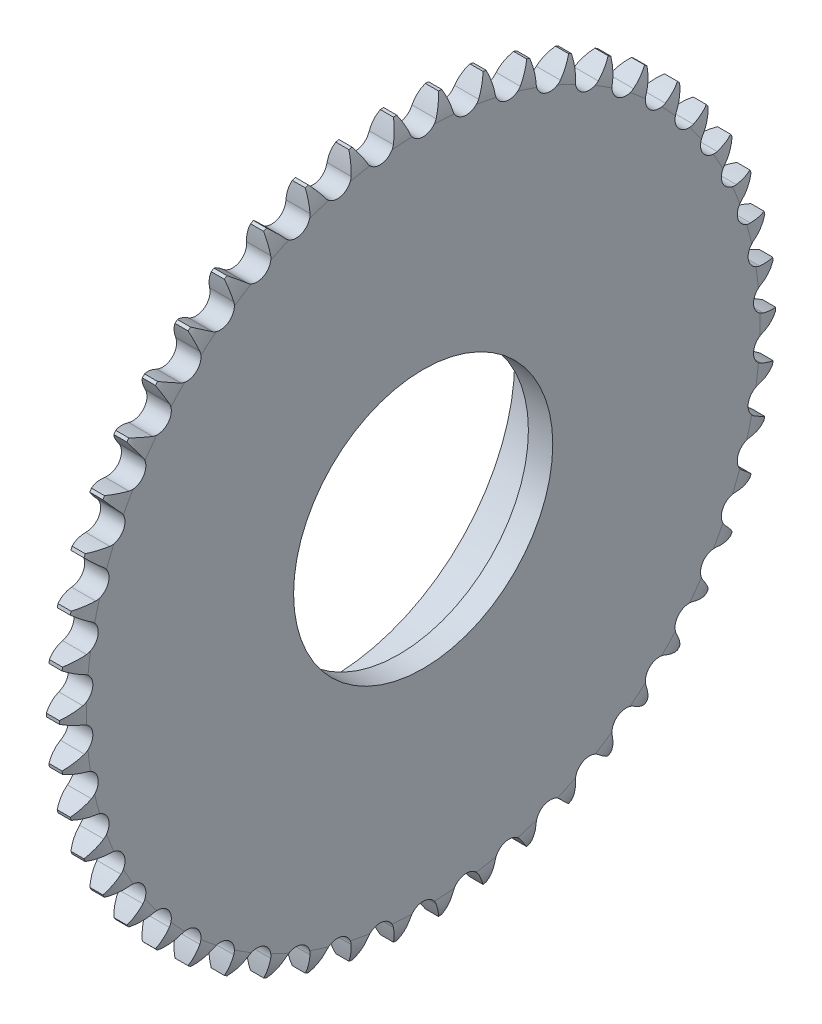
from build123d import *

# Parameters (mm, degrees)
TOOTHCUT_DEPTH           = 186.836250828
TEETHCUTS_COUNT          = 50
TEETHCUTS_ANGLE          = 352.8
HUBNEAONESKE_R           = 75
HUBNEARONE_DEPTH         = 25
HUBNEARONEFILLET_R       = 0.6
BORSKE_R                 = 47.5
BORE_DEPTH               = 25.0005
SCHIZZO2_R               = 67.5
TAGLIO_ESTRUSIONE1_DEPTH = 25


with BuildPart() as part:
    # BasProSke → Base-Revolve (revolve)
    with BuildSketch(Plane(origin=(0, 0, 0), x_dir=(1, 0, 0), z_dir=(0, 1, 0))):
        with BuildLine():
            Line((0, 0), (0, 123.427074752))
            ThreePointArc((0, 123.427074752), (0.524605563, 127.47442149), (2.06375, 131.254270829))
            Line((2.06375, 131.254270829), (6.86625, 131.254270829))
            ThreePointArc((6.86625, 131.254270829), (8.405394437, 127.47442149), (8.93, 123.427074752))
            Line((8.93, 123.427074752), (8.93, 0))
            Line((8.93, 0), (0, 0))
        make_face()
    revolve(axis=Axis((-10, 0, 0), (1, 0, 0)))

    # TooCutSke → ToothCut (cut, through all)
    with BuildSketch(Plane(origin=(0, 0, 0), x_dir=(0, 0, -1), z_dir=(1, 0, 0))):
        with BuildLine():
            ThreePointArc((4.793216317, 124.632844502), (6.245871471, 128.121287584), (7.903779946, 131.516988044))
            ThreePointArc((7.903779946, 131.516988044), (0, 131.754270829), (-7.903779946, 131.516988044))
            ThreePointArc((-7.903779946, 131.516988044), (-6.245871471, 128.121287584), (-4.793216317, 124.632844502))
            ThreePointArc((-4.793216317, 124.632844502), (0, 121.332395829), (4.793216317, 124.632844502))
        make_face()
    toothcut = extrude(amount=TOOTHCUT_DEPTH, mode=Mode.SUBTRACT)

    # TeethCuts: ToothCut ×50 about axis
    teethcuts_axis = Axis((-10, 0, 0), (1, 0, 0))
    for i in range(1, TEETHCUTS_COUNT):
        add(toothcut.rotate(teethcuts_axis, i * TEETHCUTS_ANGLE / (TEETHCUTS_COUNT - 1)), mode=Mode.SUBTRACT)

    # HubNeaOneSke → HubNearOne (add)
    with BuildSketch(Plane.ZY):
        Circle(HUBNEAONESKE_R)
    extrude(amount=HUBNEARONE_DEPTH)

    # HubNearOneFillet
    hubnearonefillet_edges = [part.edges().sort_by_distance(p)[0] for p in [
        (0, 0, -75),
    ]]
    fillet(hubnearonefillet_edges, radius=HUBNEARONEFILLET_R)

    # BorSke → Bore (cut, symmetric)
    with BuildSketch(Plane(origin=(0, 0, 0), x_dir=(0, 0, -1), z_dir=(1, 0, 0))):
        Circle(BORSKE_R)
    extrude(amount=BORE_DEPTH, both=True, mode=Mode.SUBTRACT)

    # Schizzo2 → Taglio-Estrusione1 (cut)
    with BuildSketch(Plane.ZY.offset(25)):
        Circle(SCHIZZO2_R)
    extrude(amount=-TAGLIO_ESTRUSIONE1_DEPTH, mode=Mode.SUBTRACT)


solid = part.part
